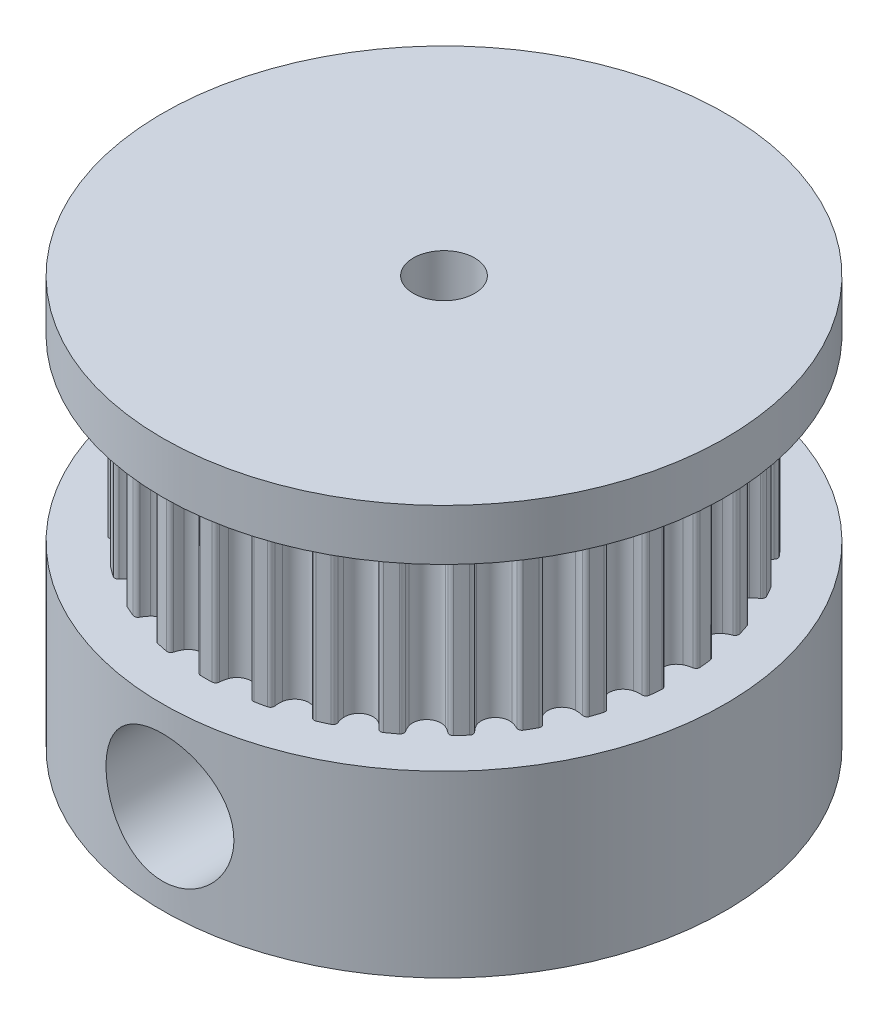
from build123d import *

# Parameters (mm, degrees)
GEAR_DEPTH              = 3.5
SKETCH2_R               = 11
SKETCH2_R_2             = 1.2
BASE_DEPTH              = 7
NUT_PASSTHROUGH_DEPTH   = 3.35
TOP_START               = 2
SKETCH9_R               = 11
TOP_DEPTH               = 2
SKETCH2_4_R             = 1.2
SHAFT_HOLE_DEPTH        = 18.972200756
SKETCH10_R              = 1.4
SCREW_HOLE_DEPTH        = 19.768324379
SCREW_START             = 4.65
SKETCH10_3_R            = 2.5
SKETCH10_3_R_2          = 1.4
SCREW_COUNTERBORE_DEPTH = 15.118324571


with BuildPart() as part:
    # Sketch1 → Gear (new, symmetric)
    with BuildSketch(Plane(origin=(0, 0, 0), x_dir=(1, 0, 0), z_dir=(0, 1, 0))):
        with BuildLine():
            ThreePointArc((0.892326679, 8.489921235), (0.608606768, 8.604567024), (0.428774911, 8.852157711))
            ThreePointArc((0.428774911, 8.852157711), (0.387828551, 8.998498922), (0.369528938, 9.149354743))
            ThreePointArc((0.369528938, 9.149354743), (0.324644398, 9.249812617), (0.22328165, 9.292614482))
            ThreePointArc((0.22328165, 9.292614482), (0, 9.295296586), (-0.22328165, 9.292614482))
            ThreePointArc((-0.22328165, 9.292614482), (-0.324644398, 9.249812617), (-0.369528938, 9.149354743))
            ThreePointArc((-0.369528938, 9.149354743), (-0.387828551, 8.998498922), (-0.428774911, 8.852157711))
            ThreePointArc((-0.428774911, 8.852157711), (-0.608606768, 8.604567024), (-0.892326679, 8.489921235))
            ThreePointArc((-0.892326679, 8.489921235), (-1.193682829, 8.543073052), (-1.421061926, 8.747864143))
            ThreePointArc((-1.421061926, 8.747864143), (-1.491539559, 8.882494221), (-1.540803971, 9.026248777))
            ThreePointArc((-1.540803971, 9.026248777), (-1.605594042, 9.115179384), (-1.713640779, 9.135971426))
            ThreePointArc((-1.713640779, 9.135971426), (-1.93260083, 9.092172053), (-2.150445599, 9.043125695))
            ThreePointArc((-2.150445599, 9.043125695), (-2.24069432, 8.980184653), (-2.263711658, 8.872590004))
            ThreePointArc((-2.263711658, 8.872590004), (-2.250246693, 8.721226041), (-2.259872228, 8.569569509))
            ThreePointArc((-2.259872228, 8.569569509), (-2.384297329, 8.290000128), (-2.637981079, 8.118870937))
            ThreePointArc((-2.637981079, 8.118870937), (-2.943802758, 8.108205793), (-3.208791539, 8.261246935))
            ThreePointArc((-3.208791539, 8.261246935), (-3.305720233, 8.378281899), (-3.383796352, 8.508652426))
            ThreePointArc((-3.383796352, 8.508652426), (-3.465660318, 8.582169073), (-3.575668883, 8.580042579))
            ThreePointArc((-3.575668883, 8.580042579), (-3.78073773, 8.491675973), (-3.983624757, 8.398408921))
            ThreePointArc((-3.983624757, 8.398408921), (-4.058815148, 8.318079528), (-4.058959317, 8.208050506))
            ThreePointArc((-4.058959317, 8.208050506), (-4.014318256, 8.062793733), (-3.992202284, 7.912449999))
            ThreePointArc((-3.992202284, 7.912449999), (-4.055782655, 7.613120446), (-4.268343047, 7.392987022))
            ThreePointArc((-4.268343047, 7.392987022), (-4.565264381, 7.318971034), (-4.856281563, 7.413573594))
            ThreePointArc((-4.856281563, 7.413573594), (-4.97542507, 7.507898455), (-5.078900595, 7.619187135))
            ThreePointArc((-5.078900595, 7.619187135), (-5.174260608, 7.674076791), (-5.281423099, 7.649124699))
            ThreePointArc((-5.281423099, 7.649124699), (-5.463638249, 7.520052905), (-5.642700397, 7.386641377))
            ThreePointArc((-5.642700397, 7.386641377), (-5.699546278, 7.292434413), (-5.676810977, 7.184779815))
            ThreePointArc((-5.676810977, 7.184779815), (-5.602944848, 7.051978649), (-5.550053943, 6.909518455))
            ThreePointArc((-5.550053943, 6.909518455), (-5.550010817, 6.603510869), (-5.712157943, 6.343994098))
            ThreePointArc((-5.712157943, 6.343994098), (-5.987202044, 6.20986212), (-6.29152878, 6.241891513))
            ThreePointArc((-6.29152878, 6.241891513), (-6.427679957, 6.309383821), (-6.552032512, 6.396726805))
            ThreePointArc((-6.552032512, 6.396726805), (-6.65672088, 6.43059053), (-6.756353782, 6.383903366))
            ThreePointArc((-6.756353782, 6.383903366), (-6.907751559, 6.219767441), (-7.055162954, 6.05204216))
            ThreePointArc((-7.055162954, 6.05204216), (-7.091179886, 5.948074921), (-7.046558756, 5.847499769))
            ThreePointArc((-7.046558756, 5.847499769), (-6.946695865, 5.732958259), (-6.865341613, 5.6046078))
            ThreePointArc((-6.865341613, 5.6046078), (-6.801676875, 5.30529618), (-6.906324126, 5.01773819))
            ThreePointArc((-6.906324126, 5.01773819), (-7.147470247, 4.829352434), (-7.451806, 4.797408821))
            ThreePointArc((-7.451806, 4.797408821), (-7.599014387, 4.835118839), (-7.738809167, 4.894698819))
            ThreePointArc((-7.738809167, 4.894698819), (-7.848250508, 4.906056604), (-7.935999384, 4.839674822))
            ThreePointArc((-7.935999384, 4.839674822), (-8.049962979, 4.647648293), (-8.159281034, 4.45293966))
            ThreePointArc((-8.159281034, 4.45293966), (-8.172894906, 4.343756013), (-8.108338105, 4.254655924))
            ThreePointArc((-8.108338105, 4.254655924), (-7.986842938, 4.163380083), (-7.880580911, 4.05474889))
            ThreePointArc((-7.880580911, 4.05474889), (-7.756077015, 3.77521459), (-7.798650805, 3.472183045))
            ThreePointArc((-7.798650805, 3.472183045), (-7.995359704, 3.237776872), (-8.28640354, 3.143256343))
            ThreePointArc((-8.28640354, 3.143256343), (-8.438235423, 3.149535962), (-8.587362727, 3.178749007))
            ThreePointArc((-8.587362727, 3.178749007), (-8.696773928, 3.167104464), (-8.768803732, 3.083929265))
            ThreePointArc((-8.768803732, 3.083929265), (-8.840352389, 2.872404613), (-8.906799381, 2.659222329))
            ThreePointArc((-8.906799381, 2.659222329), (-8.8974152, 2.549594123), (-8.81574417, 2.475863199))
            ThreePointArc((-8.81574417, 2.475863199), (-8.67792665, 2.41184222), (-8.551401008, 2.327677996))
            ThreePointArc((-8.551401008, 2.327677996), (-8.371499372, 2.080138007), (-8.350139021, 1.77487684))
            ThreePointArc((-8.350139021, 1.77487684), (-8.493813575, 1.504694924), (-8.758845482, 1.35172848))
            ThreePointArc((-8.758845482, 1.35172848), (-8.908665081, 1.32630325), (-9.060607329, 1.323872611))
            ThreePointArc((-9.060607329, 1.323872611), (-9.165206596, 1.28973466), (-9.21836928, 1.193401201))
            ThreePointArc((-9.21836928, 1.193401201), (-9.244375978, 0.971623068), (-9.265047856, 0.749284222))
            ThreePointArc((-9.265047856, 0.749284222), (-9.233075756, 0.644002736), (-9.137859913, 0.588863372))
            ThreePointArc((-9.137859913, 0.588863372), (-8.989743326, 0.554895278), (-8.848483847, 0.498876404))
            ThreePointArc((-8.848483847, 0.498876404), (-8.621047036, 0.294149412), (-8.536686094, 0))
            ThreePointArc((-8.536686094, 0), (-8.621047036, -0.294149412), (-8.848483847, -0.498876404))
            ThreePointArc((-8.848483847, -0.498876404), (-8.989743326, -0.554895278), (-9.137859913, -0.588863372))
            ThreePointArc((-9.137859913, -0.588863372), (-9.233075756, -0.644002736), (-9.265047856, -0.749284222))
            ThreePointArc((-9.265047856, -0.749284222), (-9.244375978, -0.971623068), (-9.21836928, -1.193401201))
            ThreePointArc((-9.21836928, -1.193401201), (-9.165206596, -1.28973466), (-9.060607329, -1.323872611))
            ThreePointArc((-9.060607329, -1.323872611), (-8.908665081, -1.32630325), (-8.758845482, -1.35172848))
            ThreePointArc((-8.758845482, -1.35172848), (-8.493813575, -1.504694924), (-8.350139021, -1.77487684))
            ThreePointArc((-8.350139021, -1.77487684), (-8.371499372, -2.080138007), (-8.551401008, -2.327677996))
            ThreePointArc((-8.551401008, -2.327677996), (-8.67792665, -2.41184222), (-8.81574417, -2.475863199))
            ThreePointArc((-8.81574417, -2.475863199), (-8.8974152, -2.549594123), (-8.906799381, -2.659222329))
            ThreePointArc((-8.906799381, -2.659222329), (-8.840352389, -2.872404613), (-8.768803732, -3.083929265))
            ThreePointArc((-8.768803732, -3.083929265), (-8.696773928, -3.167104464), (-8.587362727, -3.178749007))
            ThreePointArc((-8.587362727, -3.178749007), (-8.438235423, -3.149535962), (-8.28640354, -3.143256343))
            ThreePointArc((-8.28640354, -3.143256343), (-7.995359704, -3.237776872), (-7.798650805, -3.472183045))
            ThreePointArc((-7.798650805, -3.472183045), (-7.756077015, -3.77521459), (-7.880580911, -4.05474889))
            ThreePointArc((-7.880580911, -4.05474889), (-7.986842938, -4.163380083), (-8.108338105, -4.254655924))
            ThreePointArc((-8.108338105, -4.254655924), (-8.172894906, -4.343756013), (-8.159281034, -4.45293966))
            ThreePointArc((-8.159281034, -4.45293966), (-8.049962979, -4.647648293), (-7.935999384, -4.839674822))
            ThreePointArc((-7.935999384, -4.839674822), (-7.848250508, -4.906056604), (-7.738809167, -4.894698819))
            ThreePointArc((-7.738809167, -4.894698819), (-7.599014387, -4.835118839), (-7.451806, -4.797408821))
            ThreePointArc((-7.451806, -4.797408821), (-7.147470247, -4.829352434), (-6.906324126, -5.01773819))
            ThreePointArc((-6.906324126, -5.01773819), (-6.801676875, -5.30529618), (-6.865341613, -5.6046078))
            ThreePointArc((-6.865341613, -5.6046078), (-6.946695865, -5.732958259), (-7.046558756, -5.847499769))
            ThreePointArc((-7.046558756, -5.847499769), (-7.091179886, -5.948074921), (-7.055162954, -6.05204216))
            ThreePointArc((-7.055162954, -6.05204216), (-6.907751559, -6.219767441), (-6.756353782, -6.383903366))
            ThreePointArc((-6.756353782, -6.383903366), (-6.65672088, -6.43059053), (-6.552032512, -6.396726805))
            ThreePointArc((-6.552032512, -6.396726805), (-6.427679957, -6.309383821), (-6.29152878, -6.241891513))
            ThreePointArc((-6.29152878, -6.241891513), (-5.987202044, -6.20986212), (-5.712157943, -6.343994098))
            ThreePointArc((-5.712157943, -6.343994098), (-5.550010817, -6.603510869), (-5.550053943, -6.909518455))
            ThreePointArc((-5.550053943, -6.909518455), (-5.602944848, -7.051978649), (-5.676810977, -7.184779815))
            ThreePointArc((-5.676810977, -7.184779815), (-5.699546278, -7.292434413), (-5.642700397, -7.386641377))
            ThreePointArc((-5.642700397, -7.386641377), (-5.463638249, -7.520052905), (-5.281423099, -7.649124699))
            ThreePointArc((-5.281423099, -7.649124699), (-5.174260608, -7.674076791), (-5.078900595, -7.619187135))
            ThreePointArc((-5.078900595, -7.619187135), (-4.97542507, -7.507898455), (-4.856281563, -7.413573594))
            ThreePointArc((-4.856281563, -7.413573594), (-4.565264381, -7.318971034), (-4.268343047, -7.392987022))
            ThreePointArc((-4.268343047, -7.392987022), (-4.055782655, -7.613120446), (-3.992202284, -7.912449999))
            ThreePointArc((-3.992202284, -7.912449999), (-4.014318256, -8.062793733), (-4.058959317, -8.208050506))
            ThreePointArc((-4.058959317, -8.208050506), (-4.058815148, -8.318079528), (-3.983624757, -8.398408921))
            ThreePointArc((-3.983624757, -8.398408921), (-3.78073773, -8.491675973), (-3.575668883, -8.580042579))
            ThreePointArc((-3.575668883, -8.580042579), (-3.465660318, -8.582169073), (-3.383796352, -8.508652426))
            ThreePointArc((-3.383796352, -8.508652426), (-3.305720233, -8.378281899), (-3.208791539, -8.261246935))
            ThreePointArc((-3.208791539, -8.261246935), (-2.943802758, -8.108205793), (-2.637981079, -8.118870937))
            ThreePointArc((-2.637981079, -8.118870937), (-2.384297329, -8.290000128), (-2.259872228, -8.569569509))
            ThreePointArc((-2.259872228, -8.569569509), (-2.250246693, -8.721226041), (-2.263711658, -8.872590004))
            ThreePointArc((-2.263711658, -8.872590004), (-2.24069432, -8.980184653), (-2.150445599, -9.043125695))
            ThreePointArc((-2.150445599, -9.043125695), (-1.93260083, -9.092172053), (-1.713640779, -9.135971426))
            ThreePointArc((-1.713640779, -9.135971426), (-1.605594042, -9.115179384), (-1.540803971, -9.026248777))
            ThreePointArc((-1.540803971, -9.026248777), (-1.491539559, -8.882494221), (-1.421061926, -8.747864143))
            ThreePointArc((-1.421061926, -8.747864143), (-1.193682829, -8.543073052), (-0.892326679, -8.489921235))
            ThreePointArc((-0.892326679, -8.489921235), (-0.608606768, -8.604567024), (-0.428774911, -8.852157711))
            ThreePointArc((-0.428774911, -8.852157711), (-0.387828551, -8.998498922), (-0.369528938, -9.149354743))
            ThreePointArc((-0.369528938, -9.149354743), (-0.324644398, -9.249812617), (-0.22328165, -9.292614482))
            ThreePointArc((-0.22328165, -9.292614482), (0, -9.295296586), (0.22328165, -9.292614482))
            ThreePointArc((0.22328165, -9.292614482), (0.324644398, -9.249812617), (0.369528938, -9.149354743))
            ThreePointArc((0.369528938, -9.149354743), (0.387828551, -8.998498922), (0.428774911, -8.852157711))
            ThreePointArc((0.428774911, -8.852157711), (0.608606768, -8.604567024), (0.892326679, -8.489921235))
            ThreePointArc((0.892326679, -8.489921235), (1.193682829, -8.543073052), (1.421061926, -8.747864143))
            ThreePointArc((1.421061926, -8.747864143), (1.491539559, -8.882494221), (1.540803971, -9.026248777))
            ThreePointArc((1.540803971, -9.026248777), (1.605594042, -9.115179384), (1.713640779, -9.135971426))
            ThreePointArc((1.713640779, -9.135971426), (1.93260083, -9.092172053), (2.150445599, -9.043125695))
            ThreePointArc((2.150445599, -9.043125695), (2.24069432, -8.980184653), (2.263711658, -8.872590004))
            ThreePointArc((2.263711658, -8.872590004), (2.250246693, -8.721226041), (2.259872228, -8.569569509))
            ThreePointArc((2.259872228, -8.569569509), (2.384297329, -8.290000128), (2.637981079, -8.118870937))
            ThreePointArc((2.637981079, -8.118870937), (2.943802758, -8.108205793), (3.208791539, -8.261246935))
            ThreePointArc((3.208791539, -8.261246935), (3.305720233, -8.378281899), (3.383796352, -8.508652426))
            ThreePointArc((3.383796352, -8.508652426), (3.465660318, -8.582169073), (3.575668883, -8.580042579))
            ThreePointArc((3.575668883, -8.580042579), (3.78073773, -8.491675973), (3.983624757, -8.398408921))
            ThreePointArc((3.983624757, -8.398408921), (4.058815148, -8.318079528), (4.058959317, -8.208050506))
            ThreePointArc((4.058959317, -8.208050506), (4.014318256, -8.062793733), (3.992202284, -7.912449999))
            ThreePointArc((3.992202284, -7.912449999), (4.055782655, -7.613120446), (4.268343047, -7.392987022))
            ThreePointArc((4.268343047, -7.392987022), (4.565264381, -7.318971034), (4.856281563, -7.413573594))
            ThreePointArc((4.856281563, -7.413573594), (4.97542507, -7.507898455), (5.078900595, -7.619187135))
            ThreePointArc((5.078900595, -7.619187135), (5.174260608, -7.674076791), (5.281423099, -7.649124699))
            ThreePointArc((5.281423099, -7.649124699), (5.463638249, -7.520052905), (5.642700397, -7.386641377))
            ThreePointArc((5.642700397, -7.386641377), (5.699546278, -7.292434413), (5.676810977, -7.184779815))
            ThreePointArc((5.676810977, -7.184779815), (5.602944848, -7.051978649), (5.550053943, -6.909518455))
            ThreePointArc((5.550053943, -6.909518455), (5.550010817, -6.603510869), (5.712157943, -6.343994098))
            ThreePointArc((5.712157943, -6.343994098), (5.987202044, -6.20986212), (6.29152878, -6.241891513))
            ThreePointArc((6.29152878, -6.241891513), (6.427679957, -6.309383821), (6.552032512, -6.396726805))
            ThreePointArc((6.552032512, -6.396726805), (6.65672088, -6.43059053), (6.756353782, -6.383903366))
            ThreePointArc((6.756353782, -6.383903366), (6.907751559, -6.219767441), (7.055162954, -6.05204216))
            ThreePointArc((7.055162954, -6.05204216), (7.091179886, -5.948074921), (7.046558756, -5.847499769))
            ThreePointArc((7.046558756, -5.847499769), (6.946695865, -5.732958259), (6.865341613, -5.6046078))
            ThreePointArc((6.865341613, -5.6046078), (6.801676875, -5.30529618), (6.906324126, -5.01773819))
            ThreePointArc((6.906324126, -5.01773819), (7.147470247, -4.829352434), (7.451806, -4.797408821))
            ThreePointArc((7.451806, -4.797408821), (7.599014387, -4.835118839), (7.738809167, -4.894698819))
            ThreePointArc((7.738809167, -4.894698819), (7.848250508, -4.906056604), (7.935999384, -4.839674822))
            ThreePointArc((7.935999384, -4.839674822), (8.049962979, -4.647648293), (8.159281034, -4.45293966))
            ThreePointArc((8.159281034, -4.45293966), (8.172894906, -4.343756013), (8.108338105, -4.254655924))
            ThreePointArc((8.108338105, -4.254655924), (7.986842938, -4.163380083), (7.880580911, -4.05474889))
            ThreePointArc((7.880580911, -4.05474889), (7.756077015, -3.77521459), (7.798650805, -3.472183045))
            ThreePointArc((7.798650805, -3.472183045), (7.995359704, -3.237776872), (8.28640354, -3.143256343))
            ThreePointArc((8.28640354, -3.143256343), (8.438235423, -3.149535962), (8.587362727, -3.178749007))
            ThreePointArc((8.587362727, -3.178749007), (8.696773928, -3.167104464), (8.768803732, -3.083929265))
            ThreePointArc((8.768803732, -3.083929265), (8.840352389, -2.872404613), (8.906799381, -2.659222329))
            ThreePointArc((8.906799381, -2.659222329), (8.8974152, -2.549594123), (8.81574417, -2.475863199))
            ThreePointArc((8.81574417, -2.475863199), (8.67792665, -2.41184222), (8.551401008, -2.327677996))
            ThreePointArc((8.551401008, -2.327677996), (8.371499372, -2.080138007), (8.350139021, -1.77487684))
            ThreePointArc((8.350139021, -1.77487684), (8.493813575, -1.504694924), (8.758845482, -1.35172848))
            ThreePointArc((8.758845482, -1.35172848), (8.908665081, -1.32630325), (9.060607329, -1.323872611))
            ThreePointArc((9.060607329, -1.323872611), (9.165206596, -1.28973466), (9.21836928, -1.193401201))
            ThreePointArc((9.21836928, -1.193401201), (9.244375978, -0.971623068), (9.265047856, -0.749284222))
            ThreePointArc((9.265047856, -0.749284222), (9.233075756, -0.644002736), (9.137859913, -0.588863372))
            ThreePointArc((9.137859913, -0.588863372), (8.989743326, -0.554895278), (8.848483847, -0.498876404))
            ThreePointArc((8.848483847, -0.498876404), (8.621047036, -0.294149412), (8.536686094, 0))
            ThreePointArc((8.536686094, 0), (8.621047036, 0.294149412), (8.848483847, 0.498876404))
            ThreePointArc((8.848483847, 0.498876404), (8.989743326, 0.554895278), (9.137859913, 0.588863372))
            ThreePointArc((9.137859913, 0.588863372), (9.233075756, 0.644002736), (9.265047856, 0.749284222))
            ThreePointArc((9.265047856, 0.749284222), (9.244375978, 0.971623068), (9.21836928, 1.193401201))
            ThreePointArc((9.21836928, 1.193401201), (9.165206596, 1.28973466), (9.060607329, 1.323872611))
            ThreePointArc((9.060607329, 1.323872611), (8.908665081, 1.32630325), (8.758845482, 1.35172848))
            ThreePointArc((8.758845482, 1.35172848), (8.493813575, 1.504694924), (8.350139021, 1.77487684))
            ThreePointArc((8.350139021, 1.77487684), (8.371499372, 2.080138007), (8.551401008, 2.327677996))
            ThreePointArc((8.551401008, 2.327677996), (8.67792665, 2.41184222), (8.81574417, 2.475863199))
            ThreePointArc((8.81574417, 2.475863199), (8.8974152, 2.549594123), (8.906799381, 2.659222329))
            ThreePointArc((8.906799381, 2.659222329), (8.840352389, 2.872404613), (8.768803732, 3.083929265))
            ThreePointArc((8.768803732, 3.083929265), (8.696773928, 3.167104464), (8.587362727, 3.178749007))
            ThreePointArc((8.587362727, 3.178749007), (8.438235423, 3.149535962), (8.28640354, 3.143256343))
            ThreePointArc((8.28640354, 3.143256343), (7.995359704, 3.237776872), (7.798650805, 3.472183045))
            ThreePointArc((7.798650805, 3.472183045), (7.756077015, 3.77521459), (7.880580911, 4.05474889))
            ThreePointArc((7.880580911, 4.05474889), (7.986842938, 4.163380083), (8.108338105, 4.254655924))
            ThreePointArc((8.108338105, 4.254655924), (8.172894906, 4.343756013), (8.159281034, 4.45293966))
            ThreePointArc((8.159281034, 4.45293966), (8.049962979, 4.647648293), (7.935999384, 4.839674822))
            ThreePointArc((7.935999384, 4.839674822), (7.848250508, 4.906056604), (7.738809167, 4.894698819))
            ThreePointArc((7.738809167, 4.894698819), (7.599014387, 4.835118839), (7.451806, 4.797408821))
            ThreePointArc((7.451806, 4.797408821), (7.147470247, 4.829352434), (6.906324126, 5.01773819))
            ThreePointArc((6.906324126, 5.01773819), (6.801676875, 5.30529618), (6.865341613, 5.6046078))
            ThreePointArc((6.865341613, 5.6046078), (6.946695865, 5.732958259), (7.046558756, 5.847499769))
            ThreePointArc((7.046558756, 5.847499769), (7.091179886, 5.948074921), (7.055162954, 6.05204216))
            ThreePointArc((7.055162954, 6.05204216), (6.907751559, 6.219767441), (6.756353782, 6.383903366))
            ThreePointArc((6.756353782, 6.383903366), (6.65672088, 6.43059053), (6.552032512, 6.396726805))
            ThreePointArc((6.552032512, 6.396726805), (6.427679957, 6.309383821), (6.29152878, 6.241891513))
            ThreePointArc((6.29152878, 6.241891513), (5.987202044, 6.20986212), (5.712157943, 6.343994098))
            ThreePointArc((5.712157943, 6.343994098), (5.550010817, 6.603510869), (5.550053943, 6.909518455))
            ThreePointArc((5.550053943, 6.909518455), (5.602944848, 7.051978649), (5.676810977, 7.184779815))
            ThreePointArc((5.676810977, 7.184779815), (5.699546278, 7.292434413), (5.642700397, 7.386641377))
            ThreePointArc((5.642700397, 7.386641377), (5.463638249, 7.520052905), (5.281423099, 7.649124699))
            ThreePointArc((5.281423099, 7.649124699), (5.174260608, 7.674076791), (5.078900595, 7.619187135))
            ThreePointArc((5.078900595, 7.619187135), (4.97542507, 7.507898455), (4.856281563, 7.413573594))
            ThreePointArc((4.856281563, 7.413573594), (4.565264381, 7.318971034), (4.268343047, 7.392987022))
            ThreePointArc((4.268343047, 7.392987022), (4.055782655, 7.613120446), (3.992202284, 7.912449999))
            ThreePointArc((3.992202284, 7.912449999), (4.014318256, 8.062793733), (4.058959317, 8.208050506))
            ThreePointArc((4.058959317, 8.208050506), (4.058815148, 8.318079528), (3.983624757, 8.398408921))
            ThreePointArc((3.983624757, 8.398408921), (3.78073773, 8.491675973), (3.575668883, 8.580042579))
            ThreePointArc((3.575668883, 8.580042579), (3.465660318, 8.582169073), (3.383796352, 8.508652426))
            ThreePointArc((3.383796352, 8.508652426), (3.305720233, 8.378281899), (3.208791539, 8.261246935))
            ThreePointArc((3.208791539, 8.261246935), (2.943802758, 8.108205793), (2.637981079, 8.118870937))
            ThreePointArc((2.637981079, 8.118870937), (2.384297329, 8.290000128), (2.259872228, 8.569569509))
            ThreePointArc((2.259872228, 8.569569509), (2.250246693, 8.721226041), (2.263711658, 8.872590004))
            ThreePointArc((2.263711658, 8.872590004), (2.24069432, 8.980184653), (2.150445599, 9.043125695))
            ThreePointArc((2.150445599, 9.043125695), (1.93260083, 9.092172053), (1.713640779, 9.135971426))
            ThreePointArc((1.713640779, 9.135971426), (1.605594042, 9.115179384), (1.540803971, 9.026248777))
            ThreePointArc((1.540803971, 9.026248777), (1.491539559, 8.882494221), (1.421061926, 8.747864143))
            ThreePointArc((1.421061926, 8.747864143), (1.193682829, 8.543073052), (0.892326679, 8.489921235))
        make_face()
    extrude(amount=GEAR_DEPTH, both=True)

    # Sketch2 → Base (add)
    with BuildSketch(Plane.XZ.offset(3.5)):
        Circle(SKETCH2_R)
        Circle(SKETCH2_R_2, mode=Mode.SUBTRACT)
    extrude(amount=BASE_DEPTH)

    # Sketch3 → Nut Passthrough (cut)
    with BuildSketch(Plane.XY):
        Polygon((-2.65, -5.470021787), (-2.65, -10.5), (2.65, -10.5), (2.65, -5.470021787), (0, -3.940043573), align=None)
    extrude(amount=NUT_PASSTHROUGH_DEPTH, mode=Mode.SUBTRACT)

    # Sketch9 → Top (add)
    with BuildSketch(Plane(origin=(0, 3.5, 0), x_dir=(1, 0, 0), z_dir=(0, 1, 0)).offset(TOP_START)):
        Circle(SKETCH9_R)
    extrude(amount=-TOP_DEPTH)

    # Sketch2<4> → Shaft Hole (cut, through all)
    with BuildSketch(Plane.XZ.offset(3.5)):
        Circle(SKETCH2_4_R)
    extrude(amount=-SHAFT_HOLE_DEPTH, mode=Mode.SUBTRACT)

    # Sketch10 → Screw Hole (cut, through all)
    with BuildSketch(Plane.XY):
        with Locations((0, -7)):
            Circle(SKETCH10_R)
    extrude(amount=SCREW_HOLE_DEPTH, mode=Mode.SUBTRACT)

    # Sketch10<3> → Screw Counterbore (cut, through all)
    with BuildSketch(Plane.XY.offset(SCREW_START)):
        with Locations((0, -7)):
            Circle(SKETCH10_3_R)
        with Locations((0, -7)):
            Circle(SKETCH10_3_R_2, mode=Mode.SUBTRACT)
    extrude(amount=SCREW_COUNTERBORE_DEPTH, mode=Mode.SUBTRACT)


solid = part.part
